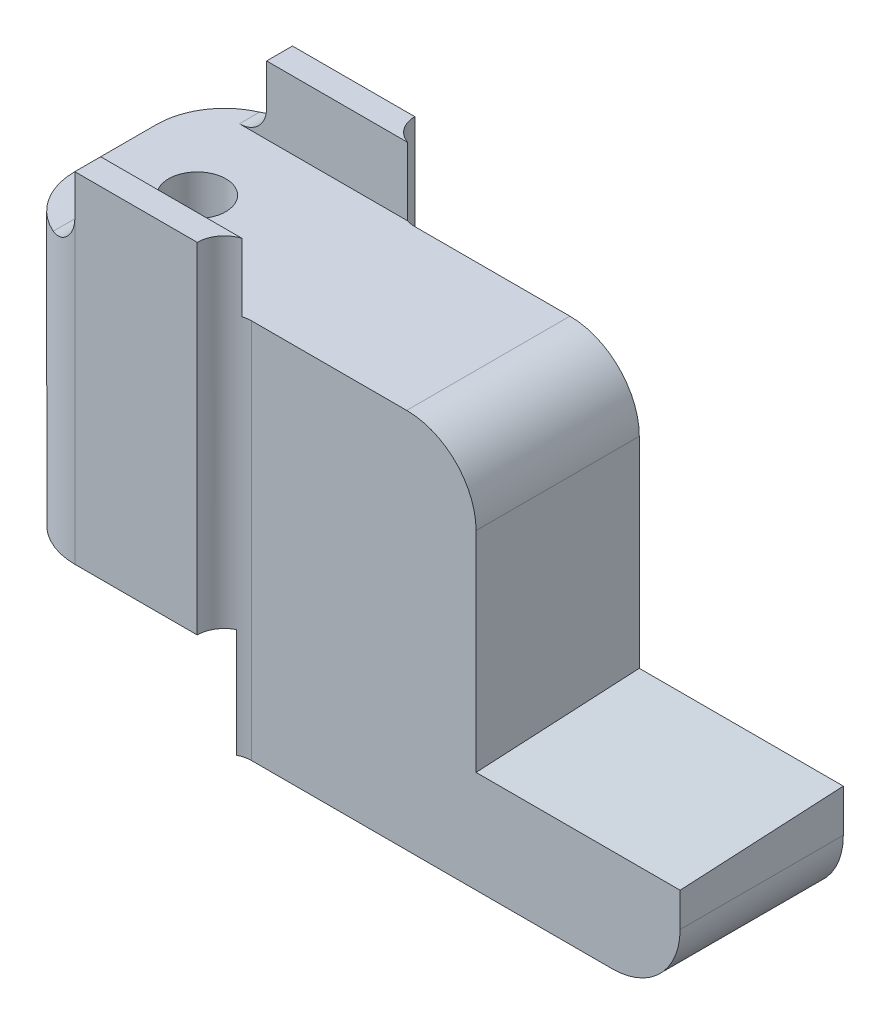
from build123d import *

# Parameters (mm, degrees)
SKETCH1_W           = 12
SKETCH1_H           = 16
SKETCH1_R           = 2.1
SKETCH1_W_2         = 2
BOSS_EXTRUDE1_DEPTH = 20
FILLET1_R           = 5
SKETCH2_W           = 9
SKETCH2_H           = 1.9
BOSS_EXTRUDE2_DEPTH = 5
SKETCH4_W           = 12
SKETCH4_H           = 20
BOSS_EXTRUDE3_DEPTH = 18.5
FILLET2_R           = 5.1
SKETCH5_W           = 17.4
SKETCH5_H           = 12
BOSS_EXTRUDE4_DEPTH = 8
BOSS_EXTRUDE5_DEPTH = 15
FILLET4_R           = 5
FILLET5_R           = 2


with BuildPart() as part:
    # Sketch1 → Boss-Extrude1 (new body)
    # profile 1 of 2: a face of its own
    with BuildSketch(Plane(origin=(0, 0, 0), x_dir=(1, 0, 0), z_dir=(0, 1, 0))):
        Rectangle(SKETCH1_W, SKETCH1_H)
        with Locations(Location((0, 0, 0), (0, 0, 270))):
            Circle(SKETCH1_R, mode=Mode.SUBTRACT)
    # profile 2 of 2: a face of its own
    with BuildSketch(Plane(origin=(0, 0, 0), x_dir=(1, 0, 0), z_dir=(0, 1, 0))):
        with Locations((7, 0)):
            Rectangle(SKETCH1_W_2, SKETCH1_H)
    extrude(amount=BOSS_EXTRUDE1_DEPTH)

    # Fillet1
    fillet1_edges = [part.edges().sort_by_distance(p)[0] for p in [
        (-6, 10, 8),
        (-6, 10, -8),
    ]]
    fillet(fillet1_edges, radius=FILLET1_R)

    # Sketch2 → Boss-Extrude2 (add)
    with BuildSketch(Plane(origin=(0, 20, 0), x_dir=(1, 0, 0), z_dir=(0, 1, 0))):
        with Locations((3.5, 7.05)):
            Rectangle(SKETCH2_W, SKETCH2_H)
        with Locations((3.5, -7.05)):
            Rectangle(SKETCH2_W, SKETCH2_H)
    extrude(amount=BOSS_EXTRUDE2_DEPTH)

    # Sketch4 → Boss-Extrude3 (add)
    with BuildSketch(Plane(origin=(8, 0, 0), x_dir=(0, 0, -1), z_dir=(1, 0, 0))):
        with Locations((0, 10)):
            Rectangle(SKETCH4_W, SKETCH4_H)
    extrude(amount=BOSS_EXTRUDE3_DEPTH)

    # Fillet2
    fillet2_edges = [part.edges().sort_by_distance(p)[0] for p in [
        (26.5, 20, 0),
    ]]
    fillet(fillet2_edges, radius=FILLET2_R)

    # Sketch5 → Boss-Extrude4 (add)
    with BuildSketch(Plane.XZ):
        with Locations((17.8, 0)):
            Rectangle(SKETCH5_W, SKETCH5_H)
    extrude(amount=BOSS_EXTRUDE4_DEPTH)

    # Sketch8 → Boss-Extrude5 (add)
    with BuildSketch(Plane(origin=(26.5, 0, 0), x_dir=(0, 0, -1), z_dir=(1, 0, 0))):
        Polygon((-6, -8), (-6, -0.5), (6, 0.128893351), (6, -8), align=None)
    extrude(amount=BOSS_EXTRUDE5_DEPTH)

    # Fillet4
    fillet4_edges = [part.edges().sort_by_distance(p)[0] for p in [
        (41.5, -8, 0),
    ]]
    fillet(fillet4_edges, radius=FILLET4_R)

    # Fillet5
    fillet5_edges = [part.edges().sort_by_distance(p)[0] for p in [
        (8, 10, 6),
    ]]
    fillet(fillet5_edges, radius=FILLET5_R - 0.0001)  # a hair under: the kernel refuses the full size
    fillet5_2_edges = [part.edges().sort_by_distance(p)[0] for p in [
        (8, 10, -6),
    ]]
    fillet(fillet5_2_edges, radius=FILLET5_R - 0.0001)  # a hair under: the kernel refuses the full size
    fillet5_3_edges = [part.edges().sort_by_distance(p)[0] for p in [
        (-1, 20, -7.05),
    ]]
    fillet(fillet5_3_edges, radius=FILLET5_R)
    fillet5_4_edges = [part.edges().sort_by_distance(p)[0] for p in [
        (-1, 20, 7.05),
    ]]
    fillet(fillet5_4_edges, radius=FILLET5_R)


solid = part.part
